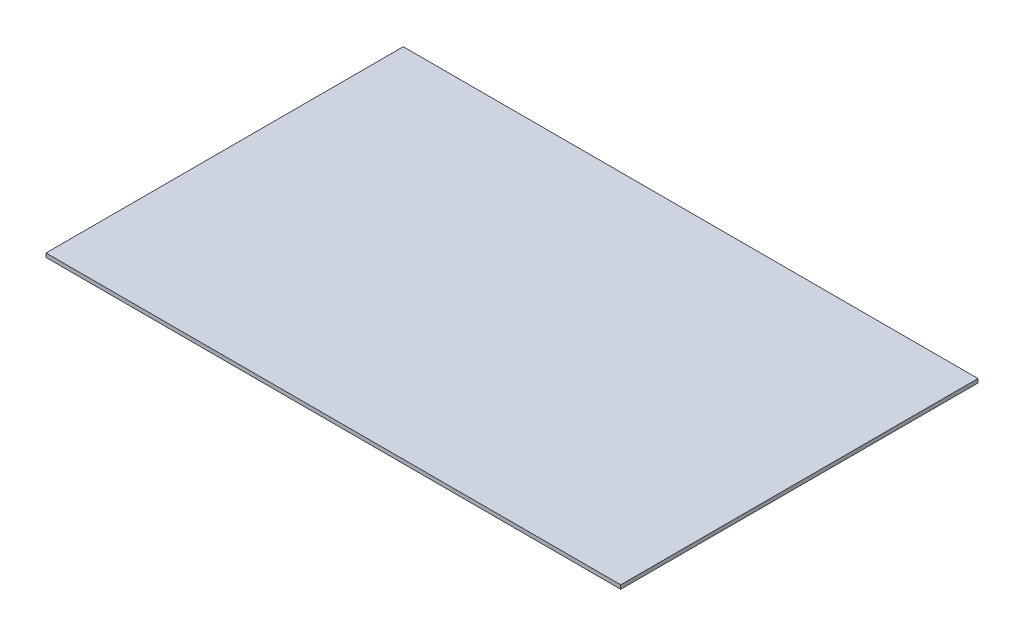
from build123d import *

# Parameters (mm, degrees)
SKETCH_1_W      = 1480
SKETCH_1_H      = 920
EXTRUDE_1_DEPTH = 10


with BuildPart() as part:
    # Эскиз1 → Бобышка-Вытянуть1 (new body)
    with BuildSketch(Plane(origin=(0, 0, 0), x_dir=(1, 0, 0), z_dir=(0, 1, 0))):
        with Locations((740, 460)):
            Rectangle(SKETCH_1_W, SKETCH_1_H)
    extrude(amount=EXTRUDE_1_DEPTH)


solid = part.part
